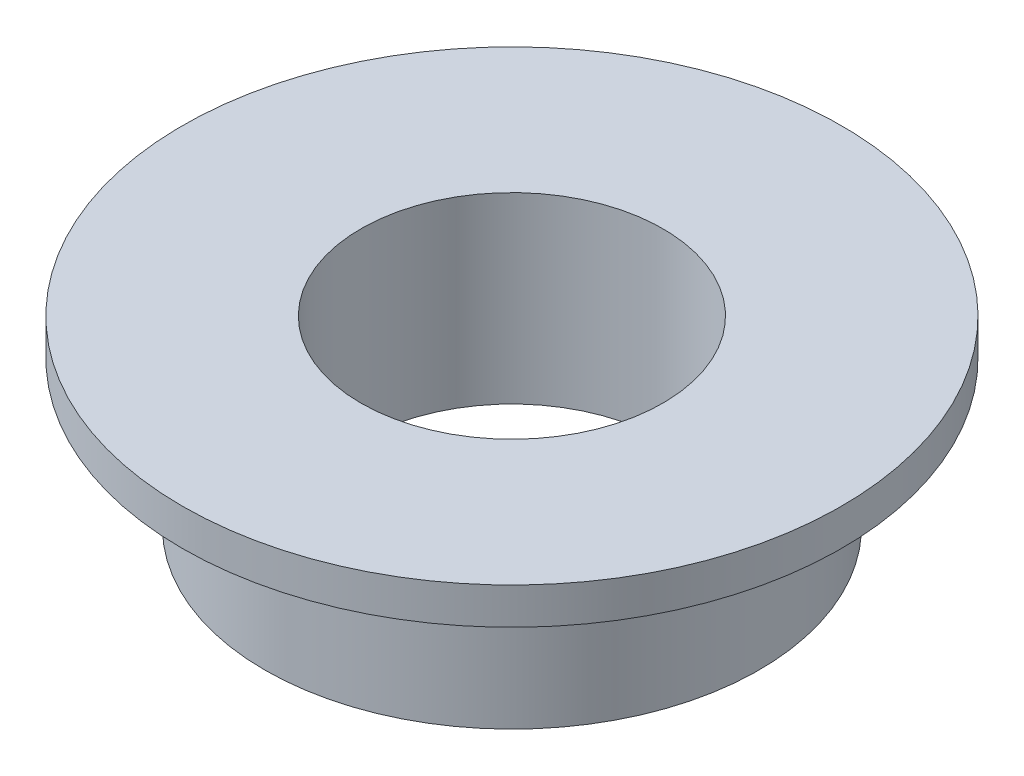
from build123d import *

# Parameters (mm, degrees)
SKETCH1_R           = 6.75
SKETCH1_R_2         = 4.125
BOSS_EXTRUDE1_DEPTH = 4
SKETCH2_R           = 9
SKETCH2_R_2         = 4.125
BOSS_EXTRUDE2_DEPTH = 1


with BuildPart() as part:
    # Sketch1 → Boss-Extrude1 (new body)
    with BuildSketch(Plane(origin=(0, 0, 0), x_dir=(1, 0, 0), z_dir=(0, 1, 0))):
        Circle(SKETCH1_R)
        Circle(SKETCH1_R_2, mode=Mode.SUBTRACT)
    extrude(amount=BOSS_EXTRUDE1_DEPTH)

    # Sketch2 → Boss-Extrude2 (add)
    with BuildSketch(Plane(origin=(0, 4, 0), x_dir=(1, 0, 0), z_dir=(0, 1, 0))):
        Circle(SKETCH2_R)
        Circle(SKETCH2_R_2, mode=Mode.SUBTRACT)
    extrude(amount=BOSS_EXTRUDE2_DEPTH)


solid = part.part
